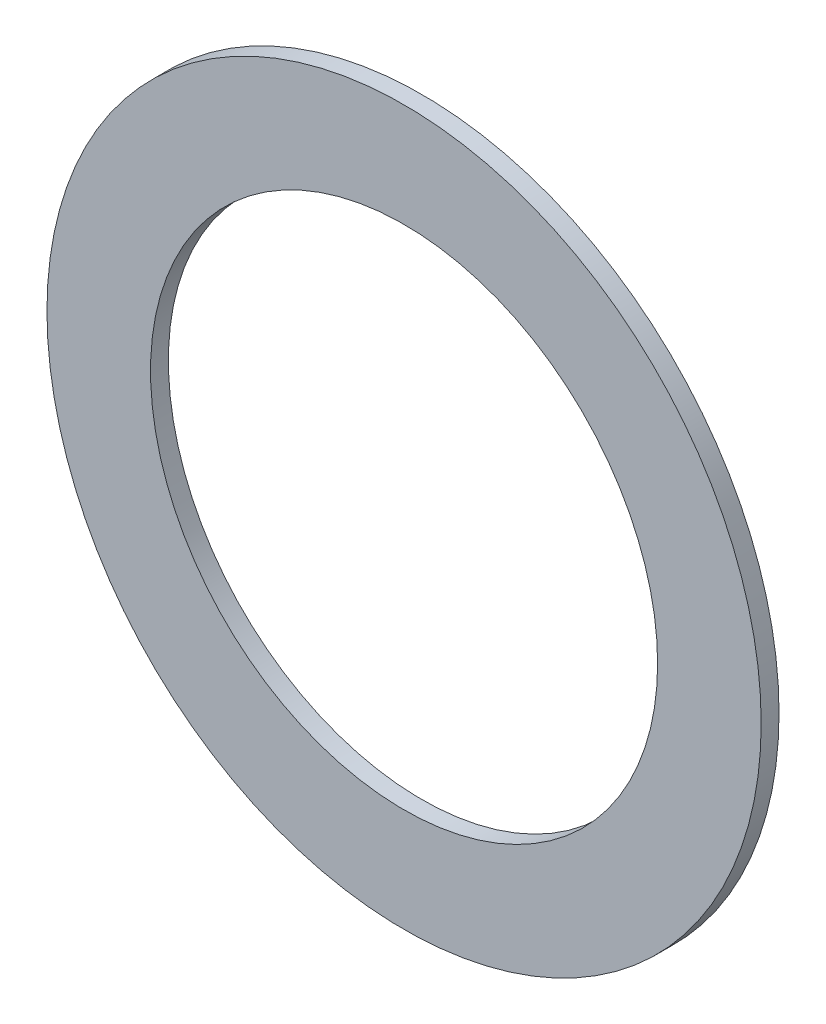
from build123d import *

# Parameters (mm, degrees)
ESQUISSE1_R      = 10
ESQUISSE1_R_2    = 7.1
EXTRUSION1_DEPTH = 0.5


with BuildPart() as part:
    # Esquisse1 → Extrusion1 (new body)
    with BuildSketch(Plane.XY):
        Circle(ESQUISSE1_R)
        Circle(ESQUISSE1_R_2, mode=Mode.SUBTRACT)
    extrude(amount=EXTRUSION1_DEPTH)


solid = part.part
